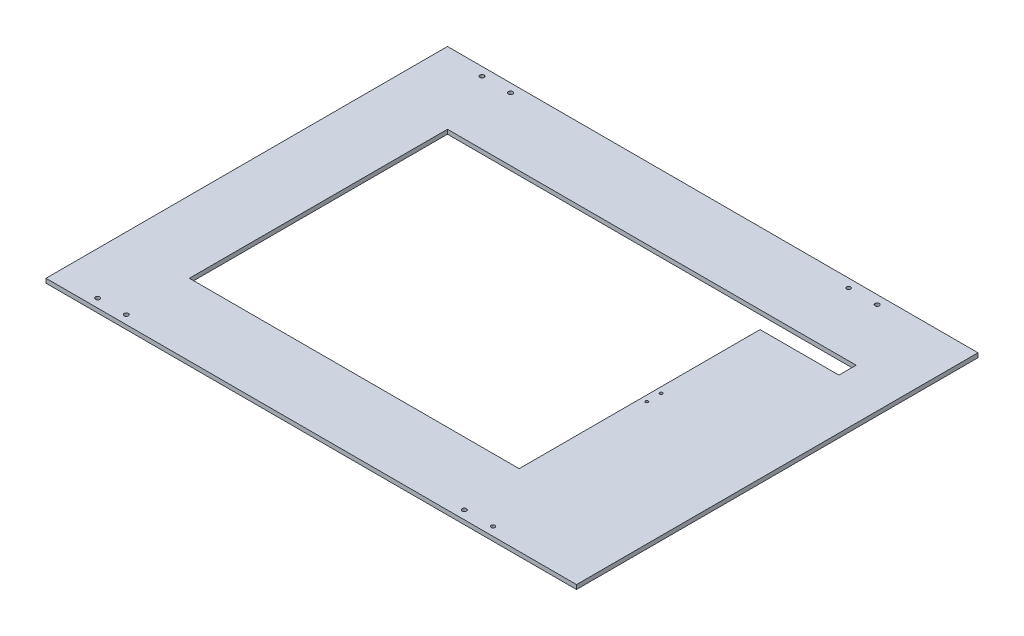
from build123d import *

# Parameters (mm, degrees)
SKETCH1_W           = 370
SKETCH1_H           = 280
SKETCH1_R           = 1.5
SKETCH1_R_2         = 1.569181713
SKETCH1_R_3         = 1.357318829
SKETCH1_R_4         = 1.322467774
SKETCH1_R_5         = 1
SKETCH1_W_2         = 230
SKETCH1_H_2         = 180
BOSS_EXTRUDE1_DEPTH = 3
SKETCH2_W           = 55
SKETCH2_H           = 12
CUT_EXTRUDE1_DEPTH  = 10


with BuildPart() as part:
    # Sketch1 → Boss-Extrude1 (new body)
    with BuildSketch(Plane(origin=(0, 0, 0), x_dir=(1, 0, 0), z_dir=(0, 1, 0))):
        with Locations((185, 140)):
            Rectangle(SKETCH1_W, SKETCH1_H)
        with Locations((30, 274)):
            Circle(SKETCH1_R, mode=Mode.SUBTRACT)
        with Locations((50, 274)):
            Circle(SKETCH1_R_2, mode=Mode.SUBTRACT)
        with Locations((30, 6)):
            Circle(SKETCH1_R, mode=Mode.SUBTRACT)
        with Locations((50, 6)):
            Circle(SKETCH1_R, mode=Mode.SUBTRACT)
        with Locations((285.756924446, 273.985388104)):
            Circle(SKETCH1_R_3, mode=Mode.SUBTRACT)
        with Locations((305.756860025, 273.934625414)):
            Circle(SKETCH1_R, mode=Mode.SUBTRACT)
        with Locations((285.756860726, 6.001523901)):
            Circle(SKETCH1_R, mode=Mode.SUBTRACT)
        with Locations((305.756860025, 6.006818111)):
            Circle(SKETCH1_R_4, mode=Mode.SUBTRACT)
        with Locations((284, 145)):
            Circle(SKETCH1_R_5, mode=Mode.SUBTRACT)
        with Locations((284, 135)):
            Circle(SKETCH1_R_5, mode=Mode.SUBTRACT)
        with Locations((165, 140)):
            Rectangle(SKETCH1_W_2, SKETCH1_H_2, mode=Mode.SUBTRACT)
    extrude(amount=BOSS_EXTRUDE1_DEPTH)

    # Sketch2 → Cut-Extrude1 (cut)
    with BuildSketch(Plane(origin=(0, 3, 0), x_dir=(1, 0, 0), z_dir=(0, 1, 0))):
        with Locations((307.5, 224)):
            Rectangle(SKETCH2_W, SKETCH2_H)
    extrude(amount=-CUT_EXTRUDE1_DEPTH, mode=Mode.SUBTRACT)


solid = part.part
